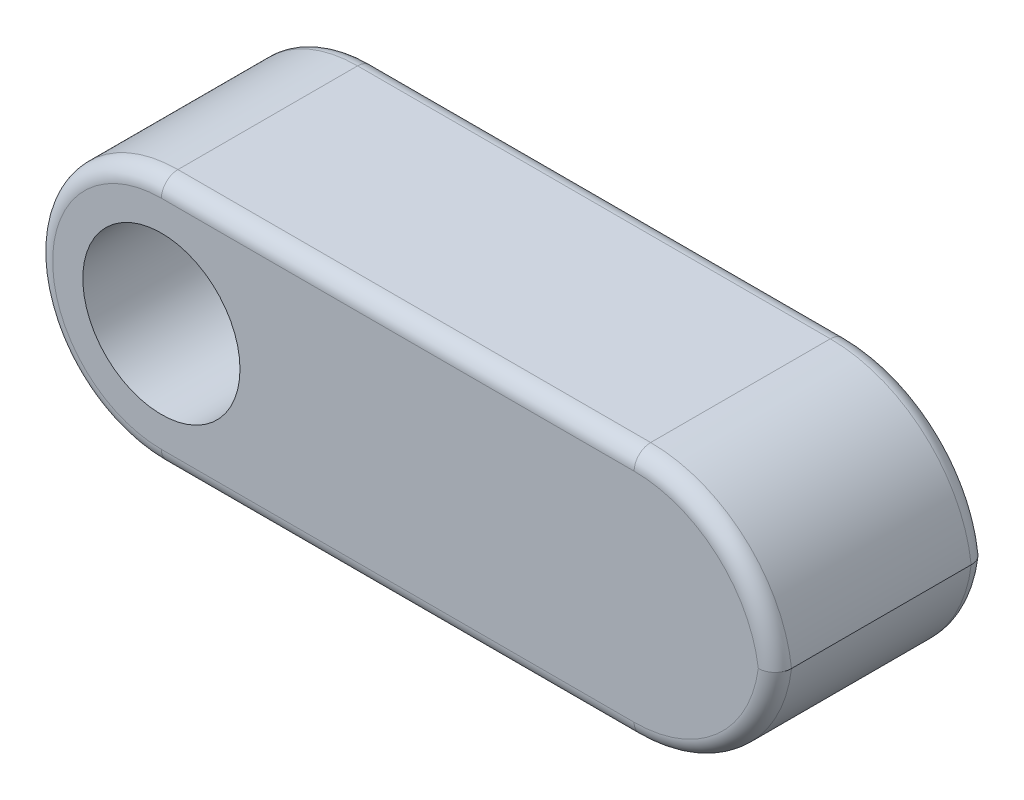
from build123d import *

# Parameters (mm, degrees)
SKETCH1_R           = 6.731
SKETCH1_R_2         = 4.22275
BOSS_EXTRUDE1_DEPTH = 11.43
FRONT_FILLET_R      = 7.62
SIDE_FILLET_R       = 0.889


with BuildPart() as part:
    # Sketch1 → Boss-Extrude1 (new body)
    # profile 1 of 2: a face of its own
    with BuildSketch(Plane.XY):
        with BuildLine():
            Line((33.02, 6.731), (0, 6.731))
            ThreePointArc((0, 6.731), (4.759535744, 4.759535744), (6.731, 0))
            ThreePointArc((6.731, 0), (4.759535744, -4.759535744), (0, -6.731))
            Line((0, -6.731), (33.02, -6.731))
            Line((33.02, -6.731), (33.02, 6.731))
        make_face()
    # profile 2 of 2: a face of its own
    with BuildSketch(Plane.XY):
        Circle(SKETCH1_R)
        Circle(SKETCH1_R_2, mode=Mode.SUBTRACT)
    extrude(amount=BOSS_EXTRUDE1_DEPTH)

    # Front Fillet
    # the kernel refuses this fillet: 7.62 mm, written as the material it takes off along each edge
    with BuildSketch(Plane(origin=(33.02, -6.731, -19.05), x_dir=(-1, 0, 0), z_dir=(0, 0, 1)), Plane(origin=(33.02, 6.731, -19.05), x_dir=(0, -1, 0), z_dir=(0, 0, 1))) as front_fillet_piece_1:
        with BuildLine():
            CenterArc((FRONT_FILLET_R, -FRONT_FILLET_R), FRONT_FILLET_R, 90, 90)
            Line((0, -FRONT_FILLET_R), (0, 0))
            Line((0, 0), (FRONT_FILLET_R, 0))
        make_face()
    extrude(amount=49.53, mode=Mode.SUBTRACT)

    # Side Fillet
    side_fillet_edges = [part.edges().sort_by_distance(p)[0] for p in [
        (-6.731, 0, 11.43),
        (12.7, -6.731, 11.43),
        (30.464100117, 4.80479399, 0),
        (30.464100117, -4.80479399, 0),
        (30.464100117, 4.80479399, 11.43),
        (30.464100117, -4.80479399, 11.43),
        (12.7, 6.731, 11.43),
        (12.7, -6.731, 0),
        (-6.731, 0, 0),
        (12.7, 6.731, 0),
    ]]
    fillet(side_fillet_edges, radius=SIDE_FILLET_R)


solid = part.part
